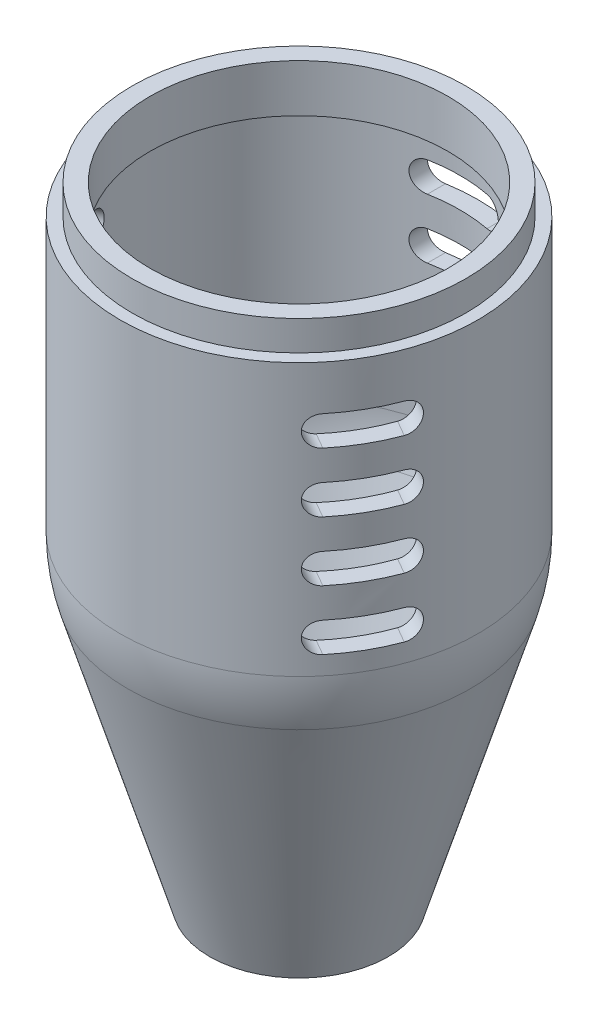
from build123d import *

# Parameters (mm, degrees)
SKETCH3_R                = 28
SKETCH3_R_2              = 25
EXTRUDE_THIN1_DEPTH      = 5
CUT_EXTRUDE3_DEPTH       = 114.247516529
LPATTERN1_COUNT          = 4
LPATTERN1_PITCH          = 10
CIRPATTERN1_COUNT        = 3
CIRPATTERN1_COPY_1_DEPTH = 114.247516529
CIRPATTERN1_COPY_2_DEPTH = 114.247516529
CIRPATTERN1_COPY_3_DEPTH = 114.247516529
CIRPATTERN1_COPY_4_DEPTH = 114.247516529
CIRPATTERN1_COPY_5_DEPTH = 114.247516529
CIRPATTERN1_COPY_6_DEPTH = 114.247516529


# Read off the part's stored shape, not the designer's step: Shell1
with BuildPart() as part:
    # Sketch1 → Revolve1 (revolve)
    with BuildSketch(Plane.XY, mode=Mode.PRIVATE) as revolve1_sk:
        with BuildLine():
            Line((30, 100), (30, 54.403065089))
            ThreePointArc((30, 54.403065089), (29.682011865, 50.046670749), (28.734788557, 45.782628522))
            Line((28.734788557, 45.782628522), (15, 0))
            Line((15, 0), (0, 0))
            Line((0, 0), (0, 100))
            Line((0, 100), (30, 100))
        make_face()
    revolve(revolve1_sk.sketch.rotate(Axis((0, 100, 0), (0, -1, 0)), 90), axis=Axis((0, 100, 0), (0, -1, 0)))

    # Sketch3 → Extrude-Thin1 (add)
    with BuildSketch(Plane(origin=(0, 100, 0), x_dir=(1, 0, 0), z_dir=(0, 1, 0))):
        Circle(SKETCH3_R)
        Circle(SKETCH3_R_2, mode=Mode.SUBTRACT)
    extrude(amount=EXTRUDE_THIN1_DEPTH)

    # Shell1 outline → Shell1 (revolve, cut)
    with BuildSketch(Plane.XY):
        with BuildLine():
            Line((25, 97), (25, 100))
            Line((25, 100), (0, 100))
            Line((0, 100), (0, 0))
            Line((0, 0), (11.867908047, 0))
            Line((11.867908047, 0), (25.861309693, 46.644672153))
            ThreePointArc((25.861309693, 46.644672153), (26.713810678, 50.482310183), (27, 54.403065116))
            Line((27, 54.403065116), (27, 97))
            Line((27, 97), (25, 97))
        make_face()
    revolve(axis=Axis((0, 0, 0), (0, 1, 0)), mode=Mode.SUBTRACT)

    # Sketch4 → Cut-Extrude3 (cut, through all)
    with BuildSketch(Plane.XY):
        with BuildLine():
            Line((-5, 62.5), (5, 62.5))
            ThreePointArc((5, 62.5), (7.5, 60), (5, 57.5))
            Line((5, 57.5), (-5, 57.5))
            ThreePointArc((-5, 57.5), (-7.5, 60), (-5, 62.5))
        make_face()
    cut_extrude3 = extrude(amount=-CUT_EXTRUDE3_DEPTH, mode=Mode.SUBTRACT)

    # LPattern1: Cut-Extrude3 ×4
    with Locations(*[(0, i * LPATTERN1_PITCH, 0) for i in range(1, LPATTERN1_COUNT)]):
        add(cut_extrude3, mode=Mode.SUBTRACT)

    # CirPattern1: Cut-Extrude3 ×3 about axis
    cirpattern1_axis = Axis((0, 100, 0), (0, 1, 0))
    for i in range(1, CIRPATTERN1_COUNT):
        add(cut_extrude3.rotate(cirpattern1_axis, i * 360 / CIRPATTERN1_COUNT), mode=Mode.SUBTRACT)

    # CirPattern1 copy 1 sketch → CirPattern1 copy 1 (cut, through all)
    with BuildSketch(Plane(origin=(0, 10, 0), x_dir=(-0.4999999999999998, 0, -0.8660254037844387), z_dir=(0.8660254037844387, 0, -0.4999999999999998))):
        with BuildLine():
            Line((-5, 62.5), (5, 62.5))
            ThreePointArc((5, 62.5), (7.5, 60), (5, 57.5))
            Line((5, 57.5), (-5, 57.5))
            ThreePointArc((-5, 57.5), (-7.5, 60), (-5, 62.5))
        make_face()
    extrude(amount=-CIRPATTERN1_COPY_1_DEPTH, mode=Mode.SUBTRACT)

    # CirPattern1 copy 2 sketch → CirPattern1 copy 2 (cut, through all)
    with BuildSketch(Plane(origin=(0, 10, 0), x_dir=(-0.5000000000000004, 0, 0.8660254037844384), z_dir=(-0.8660254037844384, 0, -0.5000000000000004))):
        with BuildLine():
            Line((-5, 62.5), (5, 62.5))
            ThreePointArc((5, 62.5), (7.5, 60), (5, 57.5))
            Line((5, 57.5), (-5, 57.5))
            ThreePointArc((-5, 57.5), (-7.5, 60), (-5, 62.5))
        make_face()
    extrude(amount=-CIRPATTERN1_COPY_2_DEPTH, mode=Mode.SUBTRACT)

    # CirPattern1 copy 3 sketch → CirPattern1 copy 3 (cut, through all)
    with BuildSketch(Plane(origin=(0, 20, 0), x_dir=(-0.4999999999999998, 0, -0.8660254037844387), z_dir=(0.8660254037844387, 0, -0.4999999999999998))):
        with BuildLine():
            Line((-5, 62.5), (5, 62.5))
            ThreePointArc((5, 62.5), (7.5, 60), (5, 57.5))
            Line((5, 57.5), (-5, 57.5))
            ThreePointArc((-5, 57.5), (-7.5, 60), (-5, 62.5))
        make_face()
    extrude(amount=-CIRPATTERN1_COPY_3_DEPTH, mode=Mode.SUBTRACT)

    # CirPattern1 copy 4 sketch → CirPattern1 copy 4 (cut, through all)
    with BuildSketch(Plane(origin=(0, 20, 0), x_dir=(-0.5000000000000004, 0, 0.8660254037844384), z_dir=(-0.8660254037844384, 0, -0.5000000000000004))):
        with BuildLine():
            Line((-5, 62.5), (5, 62.5))
            ThreePointArc((5, 62.5), (7.5, 60), (5, 57.5))
            Line((5, 57.5), (-5, 57.5))
            ThreePointArc((-5, 57.5), (-7.5, 60), (-5, 62.5))
        make_face()
    extrude(amount=-CIRPATTERN1_COPY_4_DEPTH, mode=Mode.SUBTRACT)

    # CirPattern1 copy 5 sketch → CirPattern1 copy 5 (cut, through all)
    with BuildSketch(Plane(origin=(0, 30, 0), x_dir=(-0.4999999999999998, 0, -0.8660254037844387), z_dir=(0.8660254037844387, 0, -0.4999999999999998))):
        with BuildLine():
            Line((-5, 62.5), (5, 62.5))
            ThreePointArc((5, 62.5), (7.5, 60), (5, 57.5))
            Line((5, 57.5), (-5, 57.5))
            ThreePointArc((-5, 57.5), (-7.5, 60), (-5, 62.5))
        make_face()
    extrude(amount=-CIRPATTERN1_COPY_5_DEPTH, mode=Mode.SUBTRACT)

    # CirPattern1 copy 6 sketch → CirPattern1 copy 6 (cut, through all)
    with BuildSketch(Plane(origin=(0, 30, 0), x_dir=(-0.5000000000000004, 0, 0.8660254037844384), z_dir=(-0.8660254037844384, 0, -0.5000000000000004))):
        with BuildLine():
            Line((-5, 62.5), (5, 62.5))
            ThreePointArc((5, 62.5), (7.5, 60), (5, 57.5))
            Line((5, 57.5), (-5, 57.5))
            ThreePointArc((-5, 57.5), (-7.5, 60), (-5, 62.5))
        make_face()
    extrude(amount=-CIRPATTERN1_COPY_6_DEPTH, mode=Mode.SUBTRACT)


solid = part.part
